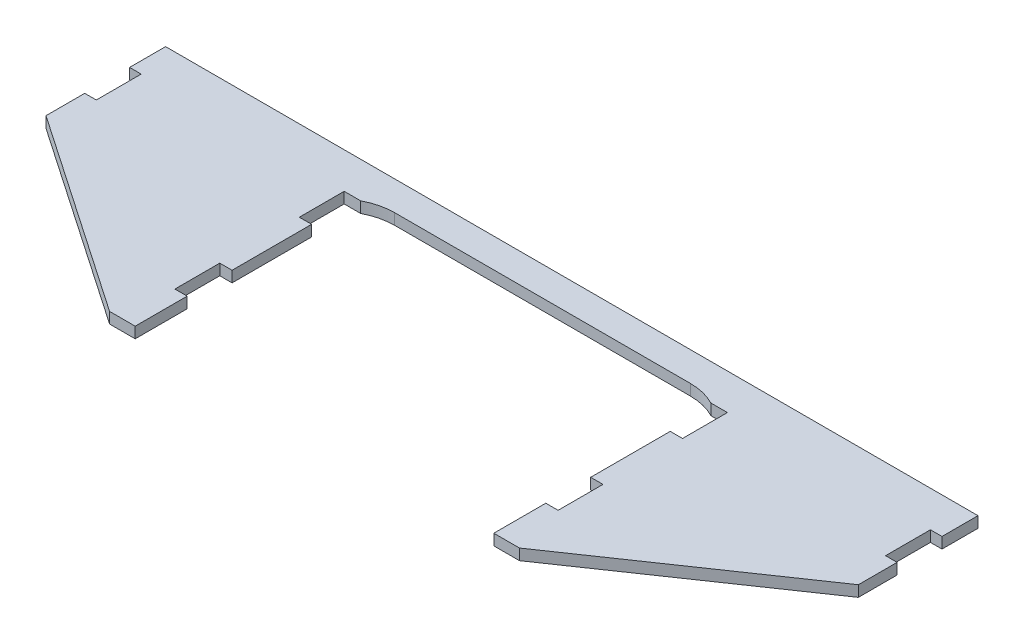
from build123d import *

# Parameters (mm, degrees)
SKETCH1_W           = 355.6
SKETCH1_H           = 50.8
BOSS_EXTRUDE1_DEPTH = 4.7625
BOSS_EXTRUDE2_DEPTH = 4.7625
SKETCH3_W           = 6.858
SKETCH3_H           = 19.471321321
SKETCH3_W_2         = 6.35
SKETCH3_H_2         = 18.963321321
CUT_EXTRUDE1_DEPTH  = 198.660000053
SKETCH4_W           = 1.5875
SKETCH4_H           = 15.621
SKETCH4_H_2         = 22.553060346
CUT_EXTRUDE2_DEPTH  = 198.660000053
CUT_EXTRUDE3_DEPTH  = 197.233230563
SKETCH6_W           = 0.3175
SKETCH6_H           = 19.471321321
CUT_EXTRUDE4_DEPTH  = 197.233230563
SKETCH7_W           = 155.575
SKETCH7_H           = 76.528060346
CUT_EXTRUDE5_DEPTH  = 197.233230563


with BuildPart() as part:
    # Sketch1 → Boss-Extrude1 (new body)
    with BuildSketch(Plane(origin=(0, 0, 0), x_dir=(1, 0, 0), z_dir=(0, 1, 0))):
        Rectangle(SKETCH1_W, SKETCH1_H)
    extrude(amount=BOSS_EXTRUDE1_DEPTH)

    # Sketch2 → Boss-Extrude2 (add)
    with BuildSketch(Plane(origin=(0, 4.7625, 0), x_dir=(1, 0, 0), z_dir=(0, 1, 0))):
        Polygon((177.8, -25.4), (88.9, -86.220381667), (76.2, -86.220381667), (76.2, -25.4), align=None)
        Polygon((-177.8, -25.4), (-88.9, -86.220381667), (-76.2, -86.220381667), (-76.2, -25.4), align=None)
    extrude(amount=-BOSS_EXTRUDE2_DEPTH)

    # Sketch3 → Cut-Extrude1 (cut, through all)
    # profile 1 of 6: a face of its own
    with BuildSketch(Plane(origin=(0, 4.7625, 0), x_dir=(1, 0, 0), z_dir=(0, 1, 0))):
        with Locations((-174.625, 0.043339339)):
            Rectangle(SKETCH3_W, SKETCH3_H)
        with Locations((-174.625, 0.04333934)):
            Rectangle(SKETCH3_W_2, SKETCH3_H_2, mode=Mode.SUBTRACT)
    # profile 2 of 6: a face of its own
    with BuildSketch(Plane(origin=(0, 4.7625, 0), x_dir=(1, 0, 0), z_dir=(0, 1, 0))):
        with Locations((-79.375, -53.931660661)):
            Rectangle(SKETCH3_W, SKETCH3_H)
        with Locations((-79.375, -53.931660661)):
            Rectangle(SKETCH3_W_2, SKETCH3_H_2, mode=Mode.SUBTRACT)
    # profile 3 of 6: a face of its own
    with BuildSketch(Plane(origin=(0, 4.7625, 0), x_dir=(1, 0, 0), z_dir=(0, 1, 0))):
        with Locations((-79.375, 0.043339339)):
            Rectangle(SKETCH3_W, SKETCH3_H)
        with Locations((-79.375, 0.04333934)):
            Rectangle(SKETCH3_W_2, SKETCH3_H_2, mode=Mode.SUBTRACT)
    # profile 4 of 6: a face of its own
    with BuildSketch(Plane(origin=(0, 4.7625, 0), x_dir=(1, 0, 0), z_dir=(0, 1, 0))):
        with Locations((79.375, 0.043339339)):
            Rectangle(SKETCH3_W, SKETCH3_H)
        with Locations((79.375, 0.04333934)):
            Rectangle(SKETCH3_W_2, SKETCH3_H_2, mode=Mode.SUBTRACT)
    # profile 5 of 6: a face of its own
    with BuildSketch(Plane(origin=(0, 4.7625, 0), x_dir=(1, 0, 0), z_dir=(0, 1, 0))):
        with Locations((79.375, -53.931660661)):
            Rectangle(SKETCH3_W, SKETCH3_H)
        with Locations((79.375, -53.931660661)):
            Rectangle(SKETCH3_W_2, SKETCH3_H_2, mode=Mode.SUBTRACT)
    # profile 6 of 6: a face of its own
    with BuildSketch(Plane(origin=(0, 4.7625, 0), x_dir=(1, 0, 0), z_dir=(0, 1, 0))):
        with Locations((174.625, 0.043339339)):
            Rectangle(SKETCH3_W, SKETCH3_H)
        with Locations((174.625, 0.04333934)):
            Rectangle(SKETCH3_W_2, SKETCH3_H_2, mode=Mode.SUBTRACT)
    extrude(amount=-CUT_EXTRUDE1_DEPTH, mode=Mode.SUBTRACT)


with BuildPart() as body_2:
    # of the pieces the cut leaves, the one that is kept (cut_extrude1_keep)
    add(part.part.solids().sort_by_distance((-177.8, 0, -25.4))[0])

    # Sketch4 → Cut-Extrude2 (cut, through all)
    with BuildSketch(Plane(origin=(0, 4.7625, 0), x_dir=(1, 0, 0), z_dir=(0, 1, 0))):
        with Locations((-177.00625, 17.5895)):
            Rectangle(SKETCH4_W, SKETCH4_H)
        with Locations((177.00625, 17.5895)):
            Rectangle(SKETCH4_W, SKETCH4_H)
        Polygon((-176.2125, -26.486078244), (-176.2125, -9.692321321), (-177.8, -9.692321321), (-177.8, -25.4), align=None)
        Polygon((177.8, -9.692321321), (176.2125, -9.692321321), (176.2125, -26.486078244), (177.8, -25.4), align=None)
        with Locations((-76.99375, -74.943851494)):
            Rectangle(SKETCH4_W, SKETCH4_H_2)
        with Locations((76.99375, -74.943851494)):
            Rectangle(SKETCH4_W, SKETCH4_H_2)
    extrude(amount=-CUT_EXTRUDE2_DEPTH, mode=Mode.SUBTRACT)

    # Sketch5 → Cut-Extrude3 (cut, through all)
    with BuildSketch(Plane(origin=(0, 4.7625, 0), x_dir=(1, 0, 0), z_dir=(0, 1, 0))):
        with BuildLine():
            Line((-76.2, -9.692321321), (-76.2, -25.4))
            Line((-76.2, -25.4), (76.2, -25.4))
            Line((76.2, -25.4), (76.2, -9.692321321))
            Line((76.2, -9.692321321), (75.946, -9.692321321))
            Line((75.946, -9.692321321), (75.946, 9.779))
            ThreePointArc((75.946, 9.779), (70.210694069, 11.958939555), (64.119988035, 12.7))
            Line((64.119988035, 12.7), (-64.119988035, 12.7))
            ThreePointArc((-64.119988035, 12.7), (-70.210694069, 11.958939555), (-75.946, 9.779))
            Line((-75.946, 9.779), (-75.946, -9.692321321))
            Line((-75.946, -9.692321321), (-76.2, -9.692321321))
        make_face()
    extrude(amount=-CUT_EXTRUDE3_DEPTH, mode=Mode.SUBTRACT)

    # Sketch6 → Cut-Extrude4 (cut, through all)
    with BuildSketch(Plane(origin=(0, 4.7625, 0), x_dir=(1, 0, 0), z_dir=(0, 1, 0))):
        with Locations((-82.96275, 0.043339339)):
            Rectangle(SKETCH6_W, SKETCH6_H)
        with Locations((-82.96275, -53.931660661)):
            Rectangle(SKETCH6_W, SKETCH6_H)
        with Locations((82.96275, -53.931660661)):
            Rectangle(SKETCH6_W, SKETCH6_H)
        with Locations((82.96275, 0.043339339)):
            Rectangle(SKETCH6_W, SKETCH6_H)
    extrude(amount=-CUT_EXTRUDE4_DEPTH, mode=Mode.SUBTRACT)

    # Sketch7 → Cut-Extrude5 (cut, through all)
    with BuildSketch(Plane(origin=(0, 4.7625, 0), x_dir=(1, 0, 0), z_dir=(0, 1, 0))):
        with Locations((0, -47.956351494)):
            Rectangle(SKETCH7_W, SKETCH7_H)
    extrude(amount=-CUT_EXTRUDE5_DEPTH, mode=Mode.SUBTRACT)


solid = body_2.part
